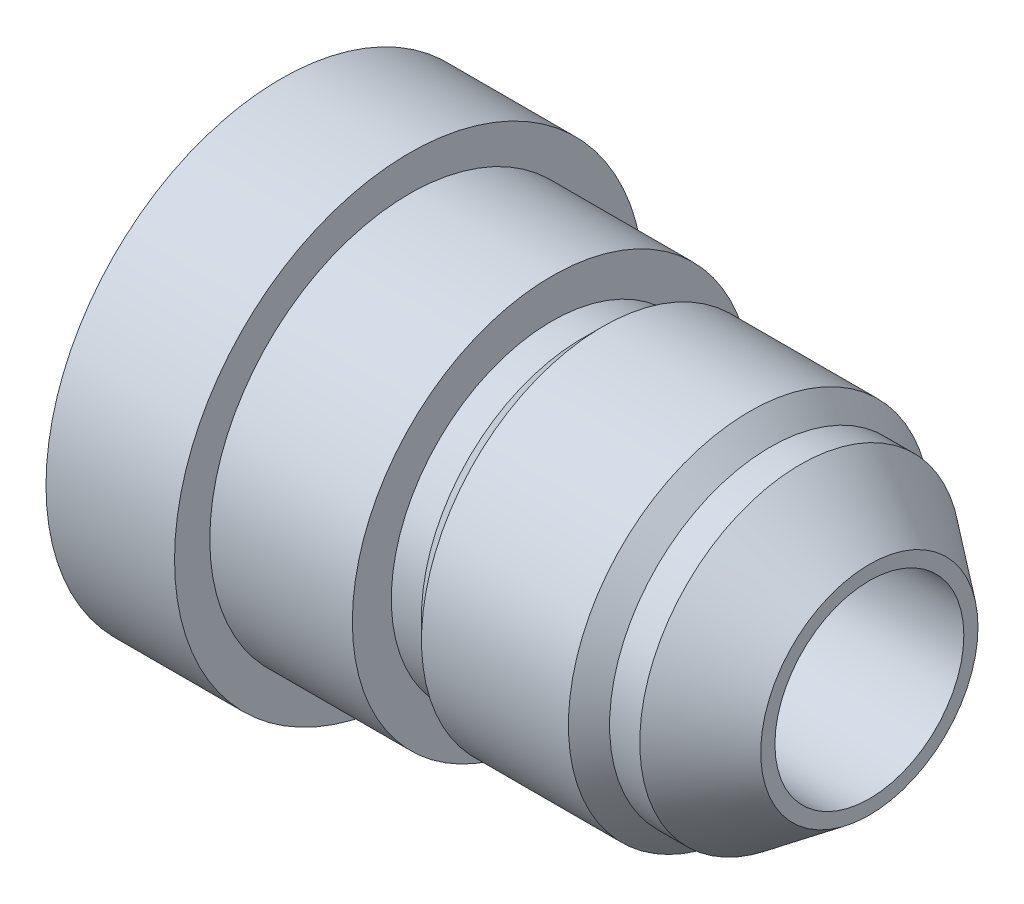
from build123d import *
from build123d.topology import SkipClean

# Parameters (mm, degrees)
CUT_SWEEP1_PITCH = 1.5875
CUT_SWEEP1_TO    = 16.6878


with BuildPart() as part:
    # Sketch1 → Revolve1 (revolve)
    with BuildSketch(Plane.XY, mode=Mode.PRIVATE) as revolve1_sk:
        Polygon((-15.4686, 12.3444), (-15.4686, 11.176), (-7.227253544, 4.9657), (15.4686, 4.9657), (15.4686, 5.710555), (15.4686, 9.525), (10.406660515, 9.525), (-1.2192, 9.525), (-1.2192, 10.4902), (-8.7122, 10.4902), (-8.7122, 12.3444), align=None)
    revolve(revolve1_sk.sketch.rotate(Axis((-15.4686, 0, 0), (1, 0, 0)), 90), axis=Axis((-15.4686, 0, 0), (1, 0, 0)))

    # Cut-Sweep1: arcs per turn and ends read off the stored shape
    # Cut-Sweep1: the profile of Sketch4 profile screwed along a right-hand helix through 12.5 turns, 8 arcs to a turn; built about Z, then put on its axis
    cut_sweep1_z = Axis((0, 0, 0), (0, 0, 1))
    cut_sweep1_corners = [(9.5253, 0, -1.587326795), (9.5253, 0, -2.976735705), (8.493888504, 0, -2.38125), (8.493888504, 0, -2.1828125)]
    with BuildLine(mode=Mode.PRIVATE) as cut_sweep1_profile:
        Line(cut_sweep1_corners[0], cut_sweep1_corners[1])
        Line(cut_sweep1_corners[1], cut_sweep1_corners[2])
        Line(cut_sweep1_corners[2], cut_sweep1_corners[3])
        Line(cut_sweep1_corners[3], cut_sweep1_corners[0])
    cut_sweep1_cap = Face(cut_sweep1_profile.wire())
    cut_sweep1_turn_angles = [0, 22.5, 45, 67.5, 90, 112.5, 135, 157.5, 180, 202.5, 225, 247.5, 270, 292.5, 315, 337.5, 360]
    cut_sweep1_turn_weights = [1, 0.9238795325112867, 1, 0.9238795325112867, 1, 0.9238795325112867, 1, 0.9238795325112867, 1, 0.9238795325112867, 1, 0.9238795325112867, 1, 0.9238795325112867, 1, 0.9238795325112867, 1]
    cut_sweep1_turn_rails = [Edge.make_bspline([Vector(p[0], p[1], 0).rotate(cut_sweep1_z, cut_sweep1_turn_angles[k]) / cut_sweep1_turn_weights[k] + Vector(0, 0, p[2] + CUT_SWEEP1_PITCH * cut_sweep1_turn_angles[k] / 360) for k in range(17)], [0, 0, 0, 1, 1, 2, 2, 3, 3, 4, 4, 5, 5, 6, 6, 7, 7, 8, 8, 8], 2, cut_sweep1_turn_weights) for p in cut_sweep1_corners]
    cut_sweep1_turn_sides = [Face.make_surface_from_curves(cut_sweep1_turn_rails[p[0]], cut_sweep1_turn_rails[p[1]]) for p in [(0, 1), (1, 2), (2, 3), (3, 0)]]
    cut_sweep1_last_angles = [4320, 4342.5, 4365, 4387.5, 4410, 4432.5, 4455, 4477.5, 4500]
    cut_sweep1_last_weights = [1, 0.9238795325112867, 1, 0.9238795325112867, 1, 0.9238795325112867, 1, 0.9238795325112867, 1]
    cut_sweep1_last_rails = [Edge.make_bspline([Vector(p[0], p[1], 0).rotate(cut_sweep1_z, cut_sweep1_last_angles[k]) / cut_sweep1_last_weights[k] + Vector(0, 0, p[2] + CUT_SWEEP1_PITCH * cut_sweep1_last_angles[k] / 360) for k in range(9)], [0, 0, 0, 1, 1, 2, 2, 3, 3, 4, 4, 4], 2, cut_sweep1_last_weights) for p in cut_sweep1_corners]
    cut_sweep1_last_sides = [Face.make_surface_from_curves(cut_sweep1_last_rails[p[0]], cut_sweep1_last_rails[p[1]]) for p in [(0, 1), (1, 2), (2, 3), (3, 0)]]
    cut_sweep1 = Plane(origin=(15.4686, 0, 0), x_dir=(0, 1, 0), z_dir=(-1, 0, 0)) * split(Solid(Shell([*[p.moved(Location((0, 0, CUT_SWEEP1_PITCH * i))) for i in range(12) for p in cut_sweep1_turn_sides], *cut_sweep1_last_sides, cut_sweep1_cap, cut_sweep1_cap.rotate(cut_sweep1_z, 4500).moved(Location((0, 0, CUT_SWEEP1_PITCH * 4500 / 360)))])), bisect_by=Plane.XY.offset(CUT_SWEEP1_TO), keep=Keep.BOTTOM, mode=Mode.PRIVATE)
    add(cut_sweep1, mode=Mode.SUBTRACT)

    # Sketch5 → Cut-Revolve1 (revolve, cut)
    with BuildSketch(Plane.XY, mode=Mode.PRIVATE) as cut_revolve1_sk:
        Polygon((15.4686, 5.710555), (11.842405564, 8.443088504), (10.254905564, 8.443088504), (9.172994068, 9.525), (15.4686, 9.525), align=None)
        Polygon((-1.2192, 9.525), (-1.2192, 8.443088504), (0.3683, 8.443088504), (1.450211496, 9.525), align=None)
    revolve(cut_revolve1_sk.sketch.rotate(Axis((0, 0, 0), (-1, 0, 0)), 90), axis=Axis((0, 0, 0), (-1, 0, 0)), mode=Mode.SUBTRACT)

    # Revolve2: read off the stored shape, not the designer's step
    # Revolve2 outline → Revolve2 (revolve)
    with SkipClean():  # the faces are left unmerged after this step: merging them gives an invalid solid
        with BuildSketch(Plane.YX):
            Polygon((9.525, 1.450211496), (9.525, 9.172994068), (8.443088504, 10.254905564), (8.443088504, 0.3683), align=None)
        revolve(axis=Axis((0, 0, 0), (1, 0, 0)))


solid = part.part
